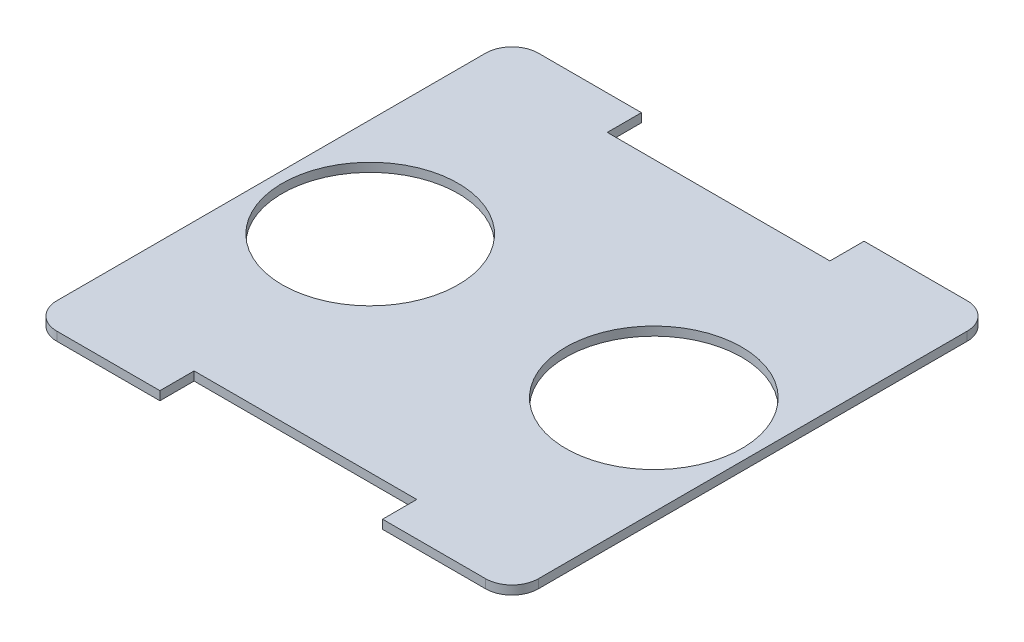
from build123d import *

# Parameters (mm, degrees)
CROQUIS1_R              = 80
SALIENTE_EXTRUIR1_DEPTH = 4


with BuildPart() as part:
    # Croquis1 → Saliente-Extruir1 (new, symmetric)
    with BuildSketch(Plane(origin=(0, 54.707138557, 0), x_dir=(1, 0, 0), z_dir=(0, 1, 0))):
        with BuildLine():
            Line((-153.357036721, -77.1), (49.152963279, -77.1))
            Line((49.152963279, -77.1), (49.152963279, -46.00446543))
            Line((49.152963279, -46.00446543), (142.897963279, -46.00446543))
            ThreePointArc((142.897963279, -46.00446543), (159.865368491, -53.032594788), (166.893497848, -70))
            Line((166.893497848, -70), (166.893497848, -460))
            ThreePointArc((166.893497848, -460), (159.865368491, -476.967405212), (142.897963279, -483.99553457))
            Line((142.897963279, -483.99553457), (49.152963279, -483.99553457))
            Line((49.152963279, -483.99553457), (49.152963279, -452.9))
            Line((49.152963279, -452.9), (-153.357036721, -452.9))
            Line((-153.357036721, -452.9), (-153.357036721, -483.99553457))
            Line((-153.357036721, -483.99553457), (-247.102036721, -483.99553457))
            ThreePointArc((-247.102036721, -483.99553457), (-264.069441934, -476.967405212), (-271.097571291, -460))
            Line((-271.097571291, -460), (-271.097571291, -70))
            ThreePointArc((-271.097571291, -70), (-264.069441934, -53.032594788), (-247.102036721, -46.00446543))
            Line((-247.102036721, -46.00446543), (-153.357036721, -46.00446543))
            Line((-153.357036721, -46.00446543), (-153.357036721, -77.1))
        make_face()
        with Locations((-181.097571291, -265)):
            Circle(CROQUIS1_R, mode=Mode.SUBTRACT)
        with Locations((76.893497848, -265)):
            Circle(CROQUIS1_R, mode=Mode.SUBTRACT)
    extrude(amount=SALIENTE_EXTRUIR1_DEPTH, both=True)


solid = part.part
